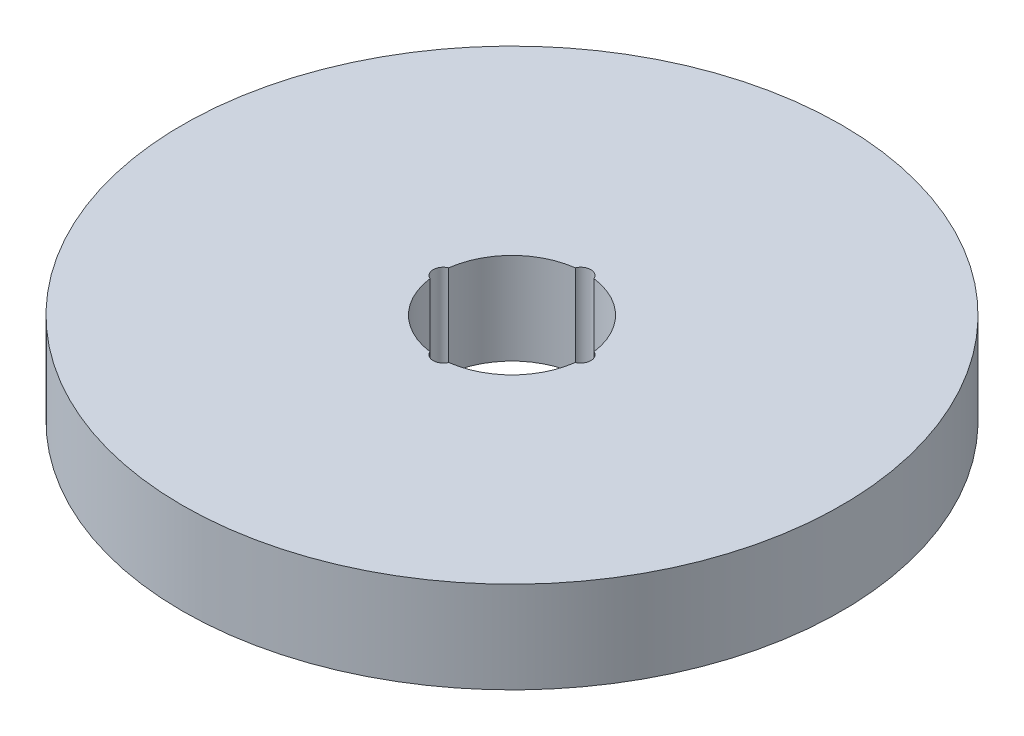
from build123d import *

# Parameters (mm, degrees)
SKETCH1_R           = 90
BOSS_EXTRUDE1_DEPTH = 25
SKETCH2_R           = 20
CUT_EXTRUDE1_DEPTH  = 130.711217711
SKETCH3_R           = 2.775603902
CUT_EXTRUDE2_DEPTH  = 24.836696363
CIRPATTERN1_COUNT   = 4


with BuildPart() as part:
    # Sketch1 → Boss-Extrude1 (new body)
    with BuildSketch(Plane(origin=(0, 0, 0), x_dir=(1, 0, 0), z_dir=(0, 1, 0))):
        Circle(SKETCH1_R)
    extrude(amount=BOSS_EXTRUDE1_DEPTH)

    # Sketch2 → Cut-Extrude1 (cut, through all)
    with BuildSketch(Plane(origin=(0, 0, 0), x_dir=(1, 0, 0), z_dir=(0, 1, 0))):
        Circle(SKETCH2_R)
    extrude(amount=CUT_EXTRUDE1_DEPTH, mode=Mode.SUBTRACT)

    # Sketch3 → Cut-Extrude2 (cut)
    with BuildSketch(Plane(origin=(0, 25, 0), x_dir=(1, 0, 0), z_dir=(0, 1, 0))):
        with Locations((-18.758028178, 0)):
            Circle(SKETCH3_R)
    cut_extrude2 = extrude(amount=-CUT_EXTRUDE2_DEPTH, mode=Mode.SUBTRACT)

    # CirPattern1: Cut-Extrude2 ×4 about axis
    cirpattern1_axis = Axis((0, 0, 0), (0, 1, 0))
    for i in range(1, CIRPATTERN1_COUNT):
        add(cut_extrude2.rotate(cirpattern1_axis, i * 360 / CIRPATTERN1_COUNT), mode=Mode.SUBTRACT)


solid = part.part
